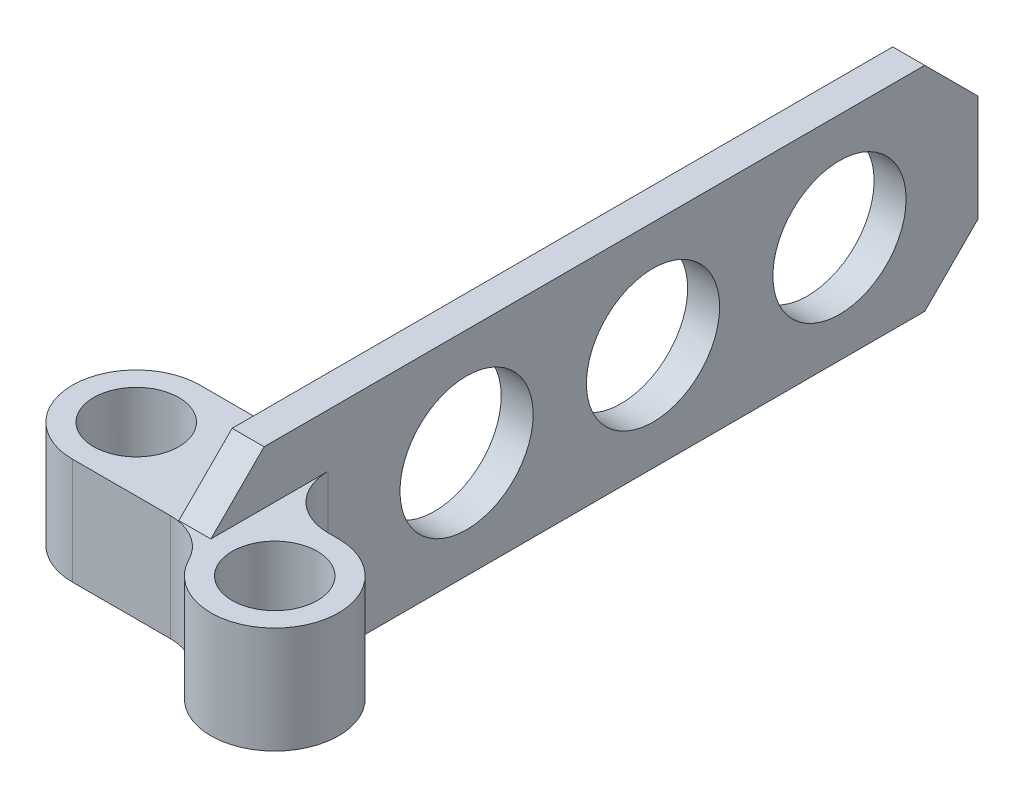
from build123d import *

# Parameters (mm, degrees)
SKETCH1_R           = 8
BOSS_EXTRUDE1_DEPTH = 40
CHAMFER1_SIZE       = 10
SKETCH2_R           = 8
BOSS_EXTRUDE2_DEPTH = 40
CUT_EXTRUDE2_REACH  = 134.076
SKETCH4_W           = 40
SKETCH4_H           = 10
FILLET4_R           = 10
CUT_EXTRUDE9_REACH  = 154.84
CUT_EXTRUDE10_REACH = 153.921
FILLET5_R           = 10
CUT_EXTRUDE11_REACH = 156.208
SKETCH15_R          = 12.5


with BuildPart() as part:
    # Sketch1 → Boss-Extrude1 (new body)
    with BuildSketch(Plane(origin=(0, 0, 0), x_dir=(1, 0, 0), z_dir=(0, 1, 0))):
        with BuildLine():
            Line((0, 0), (0, 144))
            Line((0, 144), (-6, 144))
            Line((-6, 144), (-6, 24))
            Line((-6, 24), (-26, 24))
            ThreePointArc((-26, 24), (-38, 12), (-26, 0))
            Line((-26, 0), (0, 0))
        make_face()
        with Locations(Location((-26, 12, 0), (0, 0, 270))):
            Circle(SKETCH1_R, mode=Mode.SUBTRACT)
    extrude(amount=BOSS_EXTRUDE1_DEPTH)

    # Chamfer1
    chamfer1_edges = [part.edges().sort_by_distance(p)[0] for p in [
        (-3, 40, -144),
        (-3, 0, -144),
    ]]
    chamfer(chamfer1_edges, length=CHAMFER1_SIZE)

    # Sketch2 → Boss-Extrude2 (add, through all)
    with BuildSketch(Plane(origin=(0, 40, 0), x_dir=(1, 0, 0), z_dir=(0, 1, 0))):
        with BuildLine():
            ThreePointArc((0, 0), (12, -12), (24, 0))
            Line((24, 0), (24, 24))
            Line((24, 24), (0, 24))
            Line((0, 24), (0, 0))
        make_face()
        with Locations(Location((12, 0, 0), (0, 0, 270))):
            Circle(SKETCH2_R, mode=Mode.SUBTRACT)
    extrude(amount=-BOSS_EXTRUDE2_DEPTH)

    # Sketch4 → Cut-Extrude2 (cut, up to next)
    with BuildSketch(Plane(origin=(0, 0, -24), x_dir=(-1, 0, 0), z_dir=(0, 0, -1)), mode=Mode.PRIVATE) as cut_extrude2_sk1:
        with Locations((26, 35)):
            Rectangle(SKETCH4_W, SKETCH4_H)
    cut_extrude2_tool1 = extrude(cut_extrude2_sk1.sketch, amount=-CUT_EXTRUDE2_REACH, mode=Mode.PRIVATE) & part.part
    # Sketch4 → Cut-Extrude2 (cut, up to next)
    with BuildSketch(Plane(origin=(0, 0, -24), x_dir=(-1, 0, 0), z_dir=(0, 0, -1)), mode=Mode.PRIVATE) as cut_extrude2_sk2:
        with Locations((26, 5)):
            Rectangle(SKETCH4_W, SKETCH4_H)
    cut_extrude2_tool2 = extrude(cut_extrude2_sk2.sketch, amount=-CUT_EXTRUDE2_REACH, mode=Mode.PRIVATE) & part.part
    # Sketch4 → Cut-Extrude2 (cut, up to next)
    with BuildSketch(Plane(origin=(0, 0, -24), x_dir=(-1, 0, 0), z_dir=(0, 0, -1)), mode=Mode.PRIVATE) as cut_extrude2_sk3:
        with Locations((-20, 5)):
            Rectangle(SKETCH4_W, SKETCH4_H)
    cut_extrude2_tool3 = extrude(cut_extrude2_sk3.sketch, amount=-CUT_EXTRUDE2_REACH, mode=Mode.PRIVATE) & part.part
    # Sketch4 → Cut-Extrude2 (cut, up to next)
    with BuildSketch(Plane(origin=(0, 0, -24), x_dir=(-1, 0, 0), z_dir=(0, 0, -1)), mode=Mode.PRIVATE) as cut_extrude2_sk4:
        with Locations((-20, 35)):
            Rectangle(SKETCH4_W, SKETCH4_H)
    cut_extrude2_tool4 = extrude(cut_extrude2_sk4.sketch, amount=-CUT_EXTRUDE2_REACH, mode=Mode.PRIVATE) & part.part
    add(cut_extrude2_tool1.solids().sort_by_distance((-26, 35, -24))[0], mode=Mode.SUBTRACT)
    add(cut_extrude2_tool2.solids().sort_by_distance((-26, 5, -24))[0], mode=Mode.SUBTRACT)
    add(cut_extrude2_tool3.solids().sort_by_distance((20, 5, -24))[0], mode=Mode.SUBTRACT)
    add(cut_extrude2_tool4.solids().sort_by_distance((20, 35, -24))[0], mode=Mode.SUBTRACT)

    # Fillet4
    fillet4_edges = [part.edges().sort_by_distance(p)[0] for p in [
        (-6, 20, -24),
    ]]
    fillet(fillet4_edges, radius=FILLET4_R)

    # Sketch13 → Cut-Extrude9 (cut, up to next)
    with BuildSketch(Plane.ZY.offset(6), mode=Mode.PRIVATE) as cut_extrude9_sk1:
        Polygon((0, 30), (-10, 40), (0, 40), align=None)
    cut_extrude9_tool1 = extrude(cut_extrude9_sk1.sketch, amount=-CUT_EXTRUDE9_REACH, mode=Mode.PRIVATE) & part.part
    # Sketch13 → Cut-Extrude9 (cut, up to next)
    with BuildSketch(Plane.ZY.offset(6), mode=Mode.PRIVATE) as cut_extrude9_sk2:
        Polygon((0, 10), (0, 0), (-10, 0), align=None)
    cut_extrude9_tool2 = extrude(cut_extrude9_sk2.sketch, amount=-CUT_EXTRUDE9_REACH, mode=Mode.PRIVATE) & part.part
    add(cut_extrude9_tool1.solids().sort_by_distance((-6, 36.666667, -3.333333))[0], mode=Mode.SUBTRACT)
    add(cut_extrude9_tool2.solids().sort_by_distance((-6, 3.333333, -3.333333))[0], mode=Mode.SUBTRACT)

    # Sketch14 → Cut-Extrude10 (cut, up to next)
    with BuildSketch(Plane(origin=(0, 30, 0), x_dir=(1, 0, 0), z_dir=(0, 1, 0)), mode=Mode.PRIVATE) as cut_extrude10_sk1:
        with BuildLine():
            Line((12, 12), (0, 12))
            Line((0, 12), (0, 24))
            Line((0, 24), (24, 24))
            Line((24, 24), (24, 0))
            ThreePointArc((24, 0), (20.485281374, 8.485281374), (12, 12))
        make_face()
    cut_extrude10_tool1 = extrude(cut_extrude10_sk1.sketch, amount=-CUT_EXTRUDE10_REACH, mode=Mode.PRIVATE) & part.part
    add(cut_extrude10_tool1.solids().sort_by_distance((12.903097, 30, -17.158841))[0], mode=Mode.SUBTRACT)

    # Fillet5
    # the kernel refuses this fillet: 10 mm, written as the material it adds along each edge
    with BuildSketch(Plane(origin=(0, 30, -12), x_dir=(0, 0, -1), z_dir=(0, -1, 0))) as fillet5_piece_1:
        with BuildLine():
            CenterArc((FILLET5_R, FILLET5_R), FILLET5_R, 180, 90)
            Line((0, FILLET5_R), (0, 0))
            Line((0, 0), (FILLET5_R, 0))
        make_face()
    extrude(amount=20)
    with BuildSketch(Plane(origin=(0, 10, 0), x_dir=(-1, 0, 0), z_dir=(0, 1, 0))) as fillet5_piece_2_section:
        with BuildLine():
            CenterArc((7.595917942, 10), FILLET5_R, 207.035691789, 62.964308211)
            ThreePointArc((-1.311317486, 5.454545455), (-0.332434055, 2.804978595), (0, 0))
            Line((0, 0), (7.595917942, 0))
        make_face()
    fillet5_piece_2 = extrude(amount=20, mode=Mode.PRIVATE)
    fillet5_piece_2 = split(fillet5_piece_2, bisect_by=Plane(origin=(-0.444204422, 11.816695322, 1.816695322), z_dir=(0, -0.7071067811865475, 0.7071067811865476)), keep=Keep.TOP, mode=Mode.PRIVATE)
    add(fillet5_piece_2)
    with BuildSketch(Plane(origin=(0, 10, 0), x_dir=(-1, 0, 0), z_dir=(0, 1, 0))) as fillet5_piece_3_section:
        with BuildLine():
            CenterArc((7.595917942, 10), FILLET5_R, 207.035691789, 62.964308211)
            ThreePointArc((-1.311317486, 5.454545455), (-0.332434055, 2.804978595), (0, 0))
            Line((0, 0), (7.595917942, 0))
        make_face()
    fillet5_piece_3 = extrude(amount=20, mode=Mode.PRIVATE)
    fillet5_piece_3 = split(fillet5_piece_3, bisect_by=Plane(origin=(-1.853866484, 24.485517863, 5.514482137), z_dir=(0, -0.7071067811865481, -0.707106781186547)), keep=Keep.TOP, mode=Mode.PRIVATE)
    fillet5_piece_3 = split(fillet5_piece_3, bisect_by=Plane(origin=(-1.853866484, 15.514482137, 5.514482137), z_dir=(0, 0.7071067811865475, -0.7071067811865476)), keep=Keep.TOP, mode=Mode.PRIVATE)
    add(fillet5_piece_3)
    with BuildSketch(Plane(origin=(0, 10, 0), x_dir=(-1, 0, 0), z_dir=(0, 1, 0))) as fillet5_piece_4_section:
        with BuildLine():
            CenterArc((7.595917942, 10), FILLET5_R, 207.035691789, 62.964308211)
            ThreePointArc((-1.311317486, 5.454545455), (-0.332434055, 2.804978595), (0, 0))
            Line((0, 0), (7.595917942, 0))
        make_face()
    fillet5_piece_4 = extrude(amount=20, mode=Mode.PRIVATE)
    fillet5_piece_4 = split(fillet5_piece_4, bisect_by=Plane(origin=(-0.444204422, 28.183304678, 1.816695322), z_dir=(0, 0.7071067811865481, 0.707106781186547)), keep=Keep.TOP, mode=Mode.PRIVATE)
    add(fillet5_piece_4)

    # Sketch15 → Cut-Extrude11 (cut, up to next)
    with BuildSketch(Plane(origin=(0, 0, 0), x_dir=(0, 0, -1), z_dir=(1, 0, 0)), mode=Mode.PRIVATE) as cut_extrude11_sk1:
        with Locations((83, 20)):
            Circle(SKETCH15_R)
    cut_extrude11_tool1 = extrude(cut_extrude11_sk1.sketch, amount=-CUT_EXTRUDE11_REACH, mode=Mode.PRIVATE) & part.part
    # Sketch15 → Cut-Extrude11 (cut, up to next)
    with BuildSketch(Plane(origin=(0, 0, 0), x_dir=(0, 0, -1), z_dir=(1, 0, 0)), mode=Mode.PRIVATE) as cut_extrude11_sk2:
        with Locations((118, 20)):
            Circle(SKETCH15_R)
    cut_extrude11_tool2 = extrude(cut_extrude11_sk2.sketch, amount=-CUT_EXTRUDE11_REACH, mode=Mode.PRIVATE) & part.part
    # Sketch15 → Cut-Extrude11 (cut, up to next)
    with BuildSketch(Plane(origin=(0, 0, 0), x_dir=(0, 0, -1), z_dir=(1, 0, 0)), mode=Mode.PRIVATE) as cut_extrude11_sk3:
        with Locations((48, 20)):
            Circle(SKETCH15_R)
    cut_extrude11_tool3 = extrude(cut_extrude11_sk3.sketch, amount=-CUT_EXTRUDE11_REACH, mode=Mode.PRIVATE) & part.part
    add(cut_extrude11_tool1.solids().sort_by_distance((0, 20, -83))[0], mode=Mode.SUBTRACT)
    add(cut_extrude11_tool2.solids().sort_by_distance((0, 20, -118))[0], mode=Mode.SUBTRACT)
    add(cut_extrude11_tool3.solids().sort_by_distance((0, 20, -48))[0], mode=Mode.SUBTRACT)


solid = part.part
